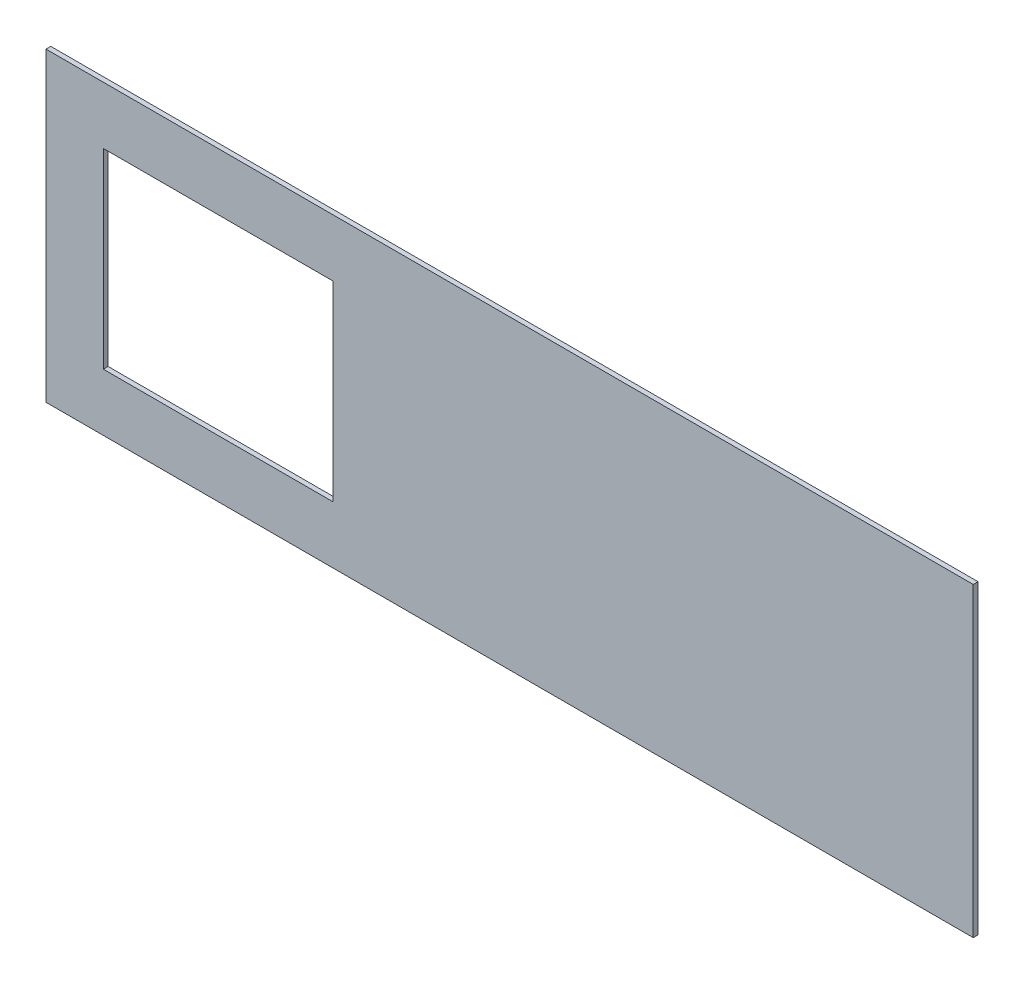
from build123d import *

# Parameters (mm, degrees)
SKETCH1_W           = 615.95
SKETCH1_H           = 203.2
BOSS_EXTRUDE1_DEPTH = 3.175
SKETCH2_W           = 152.4
SKETCH2_H           = 127
CUT_EXTRUDE1_DEPTH  = 325.316575663


with BuildPart() as part:
    # Sketch1 → Boss-Extrude1 (new body)
    with BuildSketch(Plane.XY):
        Rectangle(SKETCH1_W, SKETCH1_H)
    extrude(amount=BOSS_EXTRUDE1_DEPTH)

    # Sketch2 → Cut-Extrude1 (cut, through all)
    with BuildSketch(Plane.XY.offset(3.175)):
        with Locations((-193.675, 0)):
            Rectangle(SKETCH2_W, SKETCH2_H)
    extrude(amount=-CUT_EXTRUDE1_DEPTH, mode=Mode.SUBTRACT)


solid = part.part
